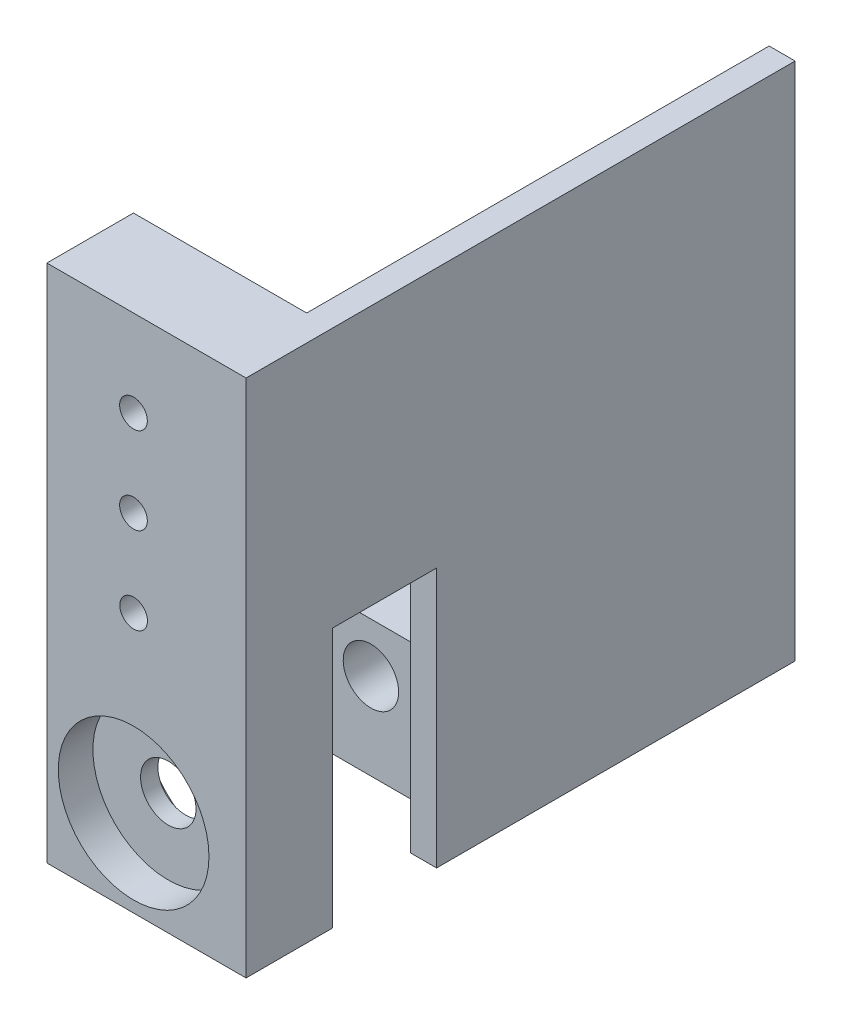
from build123d import *

# Parameters (mm, degrees)
SKETCH1_W            = 29.21
SKETCH1_H            = 76.2
BOSS_EXTRUDE1_DEPTH  = 12.7
SKETCH3_R            = 2.032
CUT_EXTRUDE1_DEPTH   = 25.4
SKETCH17_W           = 3.81
SKETCH17_H           = 76.2
BOSS_EXTRUDE13_DEPTH = 67.818
SKETCH18_W           = 3.81
SKETCH18_H           = 20.32
BOSS_EXTRUDE14_DEPTH = 25.4
SKETCH19_W           = 29.21
SKETCH19_H           = 19.948928224
BOSS_EXTRUDE15_DEPTH = 25.4
SKETCH4_R            = 4.064
CUT_EXTRUDE5_DEPTH   = 119.986544665
CUT_EXTRUDE6_START   = -5.08
SKETCH21_R           = 11.049
SKETCH21_R_2         = 4.064
CUT_EXTRUDE6_DEPTH   = 5.08
SKETCH22_R           = 11.049
SKETCH22_R_2         = 4.064
CUT_EXTRUDE7_DEPTH   = 5.08
SKETCH23_W           = 15.24
SKETCH23_H           = 38.1
CUT_EXTRUDE8_DEPTH   = 109.488248995
SKETCH24_W           = 24.012467883
SKETCH24_H           = 25.448429418
CUT_EXTRUDE9_DEPTH   = 7.62


with BuildPart() as part:
    # Sketch1 → Boss-Extrude1 (new body)
    with BuildSketch(Plane.XY):
        with Locations((19.297661272, -42.679075546)):
            Rectangle(SKETCH1_W, SKETCH1_H)
    extrude(amount=BOSS_EXTRUDE1_DEPTH)

    # Sketch3 → Cut-Extrude1 (cut)
    with BuildSketch(Plane.XY.offset(12.7)):
        with Locations((17.413506863, -42.679058438)):
            Circle(SKETCH3_R)
        with Locations((17.392661272, -29.979075546)):
            Circle(SKETCH3_R)
        with Locations((17.392661272, -17.279075546)):
            Circle(SKETCH3_R)
    extrude(amount=-CUT_EXTRUDE1_DEPTH, mode=Mode.SUBTRACT)

    # Sketch17 → Boss-Extrude13 (add)
    with BuildSketch(Plane(origin=(0, 0, 0), x_dir=(-1, 0, 0), z_dir=(0, 0, -1))):
        with Locations((-31.997661272, -42.679075546)):
            Rectangle(SKETCH17_W, SKETCH17_H)
    extrude(amount=BOSS_EXTRUDE13_DEPTH)

    # Sketch18 → Boss-Extrude14 (add)
    with BuildSketch(Plane.ZY.offset(-30.092661272)):
        with Locations((-65.913, -70.619075546)):
            Rectangle(SKETCH18_W, SKETCH18_H)
    extrude(amount=BOSS_EXTRUDE14_DEPTH)

    # Sketch19 → Boss-Extrude15 (add)
    with BuildSketch(Plane.ZY.offset(-30.092661272)):
        with Locations((-36.703, -70.804611434)):
            Rectangle(SKETCH19_W, SKETCH19_H)
    extrude(amount=BOSS_EXTRUDE15_DEPTH)

    # Sketch4 → Cut-Extrude5 (cut, through all)
    with BuildSketch(Plane.XY.offset(12.7)):
        with Locations((17.413506863, -68.079058438)):
            Circle(SKETCH4_R)
    extrude(amount=-CUT_EXTRUDE5_DEPTH, mode=Mode.SUBTRACT)

    # Sketch21 → Cut-Extrude6 (cut)
    with BuildSketch(Plane(origin=(0, 0, 0), x_dir=(-1, 0, 0), z_dir=(0, 0, -1)).offset(CUT_EXTRUDE6_START)):
        with Locations((-17.413506863, -68.079058438)):
            Circle(SKETCH21_R)
        with Locations((-17.413506863, -68.079058438)):
            Circle(SKETCH21_R_2, mode=Mode.SUBTRACT)
    extrude(amount=CUT_EXTRUDE6_DEPTH, mode=Mode.SUBTRACT)

    # Sketch22 → Cut-Extrude7 (cut)
    with BuildSketch(Plane.XY.offset(12.7)):
        with Locations((17.413506863, -68.079058438)):
            Circle(SKETCH22_R)
        with Locations((17.413506863, -68.079058438)):
            Circle(SKETCH22_R_2, mode=Mode.SUBTRACT)
    extrude(amount=-CUT_EXTRUDE7_DEPTH, mode=Mode.SUBTRACT)

    # Sketch23 → Cut-Extrude8 (cut, through all)
    with BuildSketch(Plane.ZY.offset(-30.092661272)):
        with Locations((-7.62, -61.729075546)):
            Rectangle(SKETCH23_W, SKETCH23_H)
    extrude(amount=-CUT_EXTRUDE8_DEPTH, mode=Mode.SUBTRACT)

    # Sketch24 → Cut-Extrude9 (cut)
    with BuildSketch(Plane.XZ.offset(80.779075546)):
        with Locations((18.088627796, -36.808482529)):
            Rectangle(SKETCH24_W, SKETCH24_H)
    extrude(amount=-CUT_EXTRUDE9_DEPTH, mode=Mode.SUBTRACT)


solid = part.part
